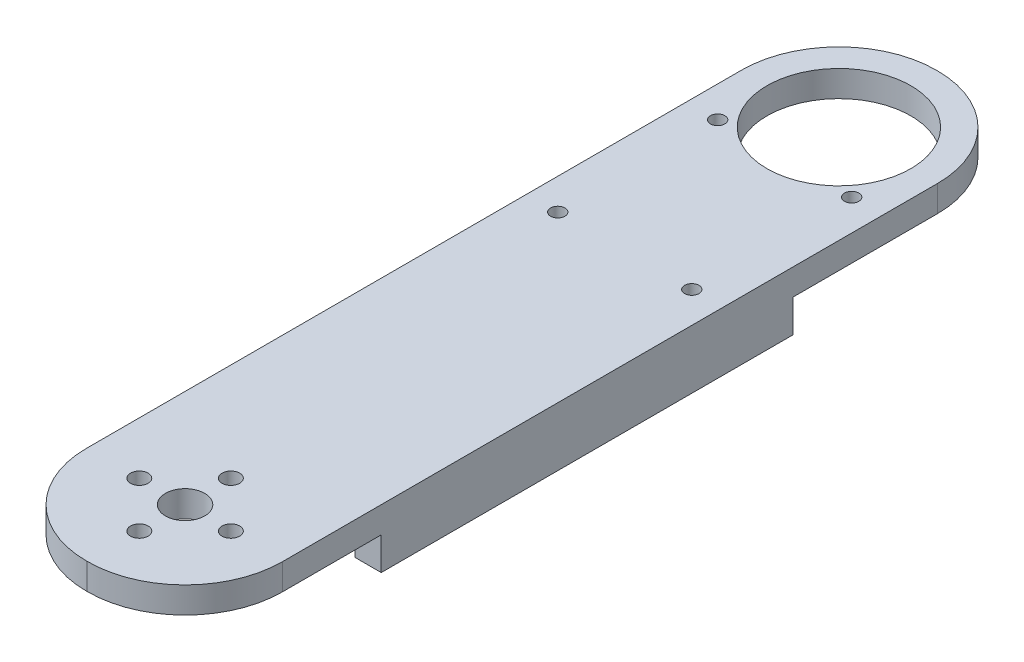
from build123d import *

# Parameters (mm, degrees)
BOSS_1_DEPTH  = 4
S_BOX2_W      = 4
S_BOX2_H      = 5.5
BOSS_2_DEPTH  = 63
S_BOX3_W      = 4
S_BOX3_H      = 5.5
BOSS_3_DEPTH  = 63
S_HOLE4_R     = 3
HOLE_4_DEPTH  = 4.2
S_HOLE5_R     = 1.35
HOLE_5_DEPTH  = 4.2
S_HOLE6_R     = 1.35
HOLE_6_DEPTH  = 4.2
S_HOLE7_R     = 1.35
HOLE_7_DEPTH  = 4.2
S_HOLE8_R     = 1.35
HOLE_8_DEPTH  = 4.2
S_HOLE9_R     = 11
HOLE_9_DEPTH  = 4.2
S_HOLE10_R    = 1.1
HOLE_10_DEPTH = 4.2
S_HOLE11_R    = 1.1
HOLE_11_DEPTH = 4.2
S_HOLE12_R    = 1.1
HOLE_12_DEPTH = 4.2
S_HOLE13_R    = 1.1
HOLE_13_DEPTH = 4.2


with BuildPart() as part:
    # S_prism1 → Boss_1 (new body)
    with BuildSketch(Plane(origin=(0, -20, 0), x_dir=(1, 0, 0), z_dir=(0, 1, 0))):
        with BuildLine():
            Line((-0.1, -15), (0.1, -15))
            ThreePointArc((0.1, -15), (10.6359, -10.6359), (15, -0.1))
            Line((15, -0.1), (15, 100.1))
            ThreePointArc((15, 100.1), (10.6359, 110.6359), (0.1, 115))
            Line((0.1, 115), (-0.1, 115))
            ThreePointArc((-0.1, 115), (-10.6359, 110.6359), (-15, 100.1))
            Line((-15, 100.1), (-15, -0.1))
            ThreePointArc((-15, -0.1), (-10.6359, -10.6359), (-0.1, -15))
        make_face()
    extrude(amount=BOSS_1_DEPTH)

    # S_box2 → Boss_2 (add)
    with BuildSketch(Plane.XY.offset(-78)):
        with Locations((-13, -22.25)):
            Rectangle(S_BOX2_W, S_BOX2_H)
    extrude(amount=BOSS_2_DEPTH)

    # S_box3 → Boss_3 (add)
    with BuildSketch(Plane.XY.offset(-78)):
        with Locations((13, -22.25)):
            Rectangle(S_BOX3_W, S_BOX3_H)
    extrude(amount=BOSS_3_DEPTH)

    # S_hole4 → Hole_4 (cut)
    with BuildSketch(Plane(origin=(0, -20.1, 0), x_dir=(1, 0, 0), z_dir=(0, 1, 0))):
        Circle(S_HOLE4_R)
    extrude(amount=HOLE_4_DEPTH, mode=Mode.SUBTRACT)

    # S_hole5 → Hole_5 (cut)
    with BuildSketch(Plane(origin=(0, -20.1, 0), x_dir=(1, 0, 0), z_dir=(0, 1, 0))):
        with Locations((7, 0)):
            Circle(S_HOLE5_R)
    extrude(amount=HOLE_5_DEPTH, mode=Mode.SUBTRACT)

    # S_hole6 → Hole_6 (cut)
    with BuildSketch(Plane(origin=(0, -20.1, 0), x_dir=(1, 0, 0), z_dir=(0, 1, 0))):
        with Locations((0, -7)):
            Circle(S_HOLE6_R)
    extrude(amount=HOLE_6_DEPTH, mode=Mode.SUBTRACT)

    # S_hole7 → Hole_7 (cut)
    with BuildSketch(Plane(origin=(0, -20.1, 0), x_dir=(1, 0, 0), z_dir=(0, 1, 0))):
        with Locations((-7, 0)):
            Circle(S_HOLE7_R)
    extrude(amount=HOLE_7_DEPTH, mode=Mode.SUBTRACT)

    # S_hole8 → Hole_8 (cut)
    with BuildSketch(Plane(origin=(0, -20.1, 0), x_dir=(1, 0, 0), z_dir=(0, 1, 0))):
        with Locations((0, 7)):
            Circle(S_HOLE8_R)
    extrude(amount=HOLE_8_DEPTH, mode=Mode.SUBTRACT)

    # S_hole9 → Hole_9 (cut)
    with BuildSketch(Plane(origin=(0, -20.1, 0), x_dir=(1, 0, 0), z_dir=(0, 1, 0))):
        with Locations((0, 100)):
            Circle(S_HOLE9_R)
    extrude(amount=HOLE_9_DEPTH, mode=Mode.SUBTRACT)

    # S_hole10 → Hole_10 (cut)
    with BuildSketch(Plane(origin=(0, -20.1, 0), x_dir=(1, 0, 0), z_dir=(0, 1, 0))):
        with Locations((-10.25, 91.7)):
            Circle(S_HOLE10_R)
    extrude(amount=HOLE_10_DEPTH, mode=Mode.SUBTRACT)

    # S_hole11 → Hole_11 (cut)
    with BuildSketch(Plane(origin=(0, -20.1, 0), x_dir=(1, 0, 0), z_dir=(0, 1, 0))):
        with Locations((10.25, 91.7)):
            Circle(S_HOLE11_R)
    extrude(amount=HOLE_11_DEPTH, mode=Mode.SUBTRACT)

    # S_hole12 → Hole_12 (cut)
    with BuildSketch(Plane(origin=(0, -20.1, 0), x_dir=(1, 0, 0), z_dir=(0, 1, 0))):
        with Locations((-10.25, 67.25)):
            Circle(S_HOLE12_R)
    extrude(amount=HOLE_12_DEPTH, mode=Mode.SUBTRACT)

    # S_hole13 → Hole_13 (cut)
    with BuildSketch(Plane(origin=(0, -20.1, 0), x_dir=(1, 0, 0), z_dir=(0, 1, 0))):
        with Locations((10.25, 67.25)):
            Circle(S_HOLE13_R)
    extrude(amount=HOLE_13_DEPTH, mode=Mode.SUBTRACT)


solid = part.part
